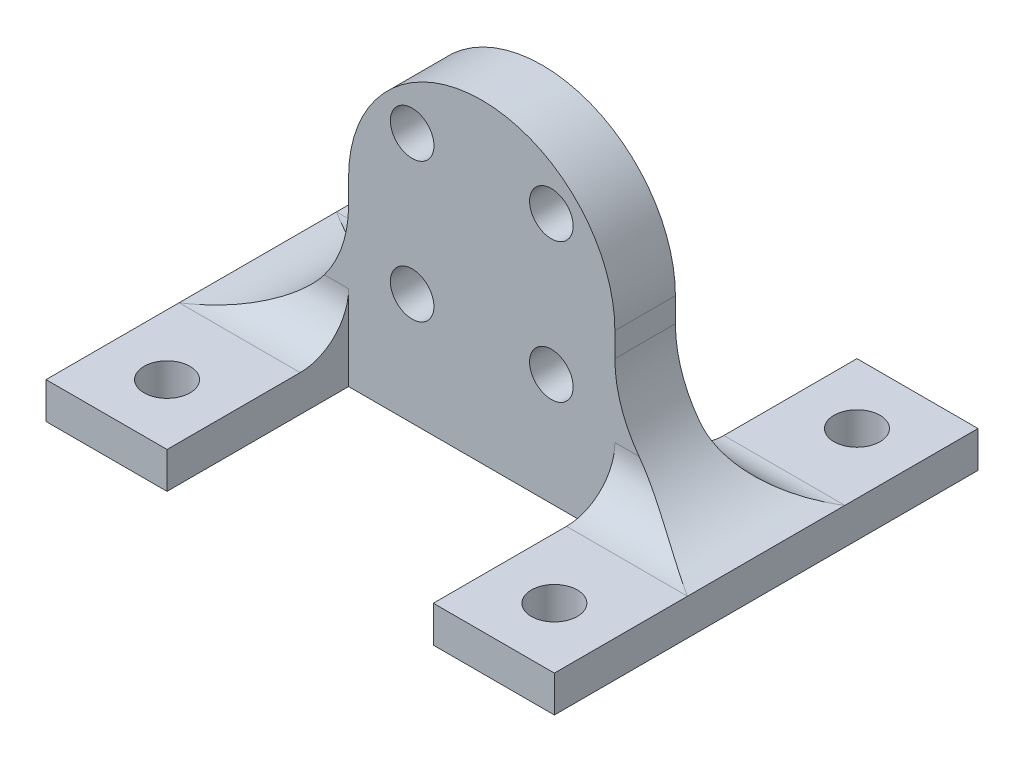
from build123d import *

# Parameters (mm, degrees)
SKETCH1_R           = 11
SKETCH1_R_2         = 1.8
BOSS_EXTRUDE1_DEPTH = 5
BOSS_EXTRUDE2_DEPTH = 5
SKETCH3_R           = 1.9
BOSS_EXTRUDE3_DEPTH = 3
FILLET2_R           = 10
FILLET3_R           = 4


with BuildPart() as part:
    # Sketch1 → Boss-Extrude1 (new body)
    with BuildSketch(Plane.XY):
        Circle(SKETCH1_R)
        with Locations((-5.75, 5.75)):
            Circle(SKETCH1_R_2, mode=Mode.SUBTRACT)
        with Locations((5.75, 5.75)):
            Circle(SKETCH1_R_2, mode=Mode.SUBTRACT)
        with Locations((5.75, -5.75)):
            Circle(SKETCH1_R_2, mode=Mode.SUBTRACT)
        with Locations((-5.75, -5.75)):
            Circle(SKETCH1_R_2, mode=Mode.SUBTRACT)
    extrude(amount=BOSS_EXTRUDE1_DEPTH)

    # Sketch2 → Boss-Extrude2 (add)
    with BuildSketch(Plane(origin=(0, 0, 0), x_dir=(-1, 0, 0), z_dir=(0, 0, -1))):
        with BuildLine():
            Line((-11, 0), (-11, -12))
            Line((-11, -12), (11, -12))
            Line((11, -12), (11, 0))
            ThreePointArc((11, 0), (0, -11), (-11, 0))
        make_face()
    extrude(amount=-BOSS_EXTRUDE2_DEPTH)

    # Sketch3 → Boss-Extrude3 (add)
    with BuildSketch(Plane.XZ.offset(12)):
        Polygon((-11, 5), (-11, 20), (-21, 20), (-21, -15), (-11, -15), (-11, 0), (11, 0), (11, -15), (21, -15), (21, 20), (11, 20), (11, 5), align=None)
        with Locations(Location((16, -10, 0), (0, 0, 270))):
            Circle(SKETCH3_R, mode=Mode.SUBTRACT)
        with Locations(Location((16, 15, 0), (0, 0, 90))):
            Circle(SKETCH3_R, mode=Mode.SUBTRACT)
        with Locations(Location((-16, 15, 0), (0, 0, 270))):
            Circle(SKETCH3_R, mode=Mode.SUBTRACT)
        with Locations(Location((-16, -10, 0), (0, 0, 90))):
            Circle(SKETCH3_R, mode=Mode.SUBTRACT)
    extrude(amount=BOSS_EXTRUDE3_DEPTH)

    # Fillet2
    fillet2_edges = [part.edges().sort_by_distance(p)[0] for p in [
        (11, -12, 2.5),
        (-11, -12, 2.5),
    ]]
    fillet(fillet2_edges, radius=FILLET2_R - 0.0001)  # a hair under: the kernel refuses the full size

    # Fillet3
    fillet3_edges = [part.edges().sort_by_distance(p)[0] for p in [
        (15.99995, -12, 5),
        (15.99995, -12, 0),
        (-15.99995, -12, 5),
        (-15.99995, -12, 0),
    ]]
    fillet(fillet3_edges, radius=FILLET3_R)


solid = part.part
